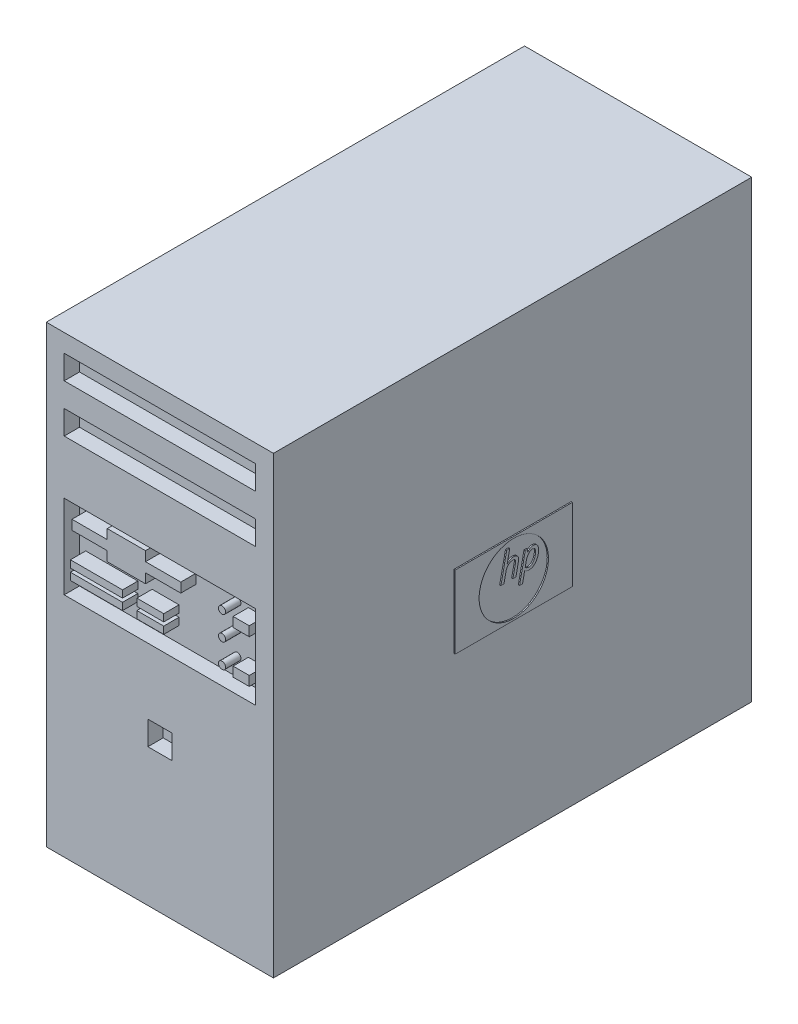
from build123d import *

# Parameters (mm, degrees)
CROQUIS1_W              = 400
CROQUIS1_H              = 380
SALIENTE_EXTRUIR1_DEPTH = 95
CROQUIS2_W              = 30.4
CROQUIS2_H              = 21.7
CROQUIS2_W_2            = 1
CROQUIS2_H_2            = 5
CORTAR_EXTRUIR1_DEPTH   = 14
CROQUIS3_W              = 45
CROQUIS3_H              = 150
CROQUIS3_W_2            = 100
CROQUIS3_H_2            = 15
SALIENTE_EXTRUIR2_DEPTH = 3
CROQUIS4_R              = 6.15
CROQUIS4_R_2            = 4
CROQUIS4_W              = 5
CROQUIS4_H              = 13
CROQUIS4_W_2            = 12
SALIENTE_EXTRUIR3_DEPTH = 5
CROQUIS5_R              = 4.1
CROQUIS5_R_2            = 5.55
SALIENTE_EXTRUIR4_DEPTH = 5
CROQUIS6_W              = 160
CROQUIS6_H              = 70
CROQUIS6_W_2            = 43.6
CROQUIS6_H_2            = 6
CROQUIS6_W_3            = 22.5
CROQUIS6_R              = 3
CROQUIS6_W_4            = 13.5
CROQUIS6_H_3            = 8
CROQUIS6_H_4            = 20
CROQUIS6_W_5            = 20
CORTAR_EXTRUIR2_DEPTH   = 12.8
ENVOLVER1_DEPTH         = 1
CROQUIS11_W             = 98
CROQUIS11_H             = 61
CROQUIS11_R             = 29
SALIENTE_EXTRUIR5_DEPTH = 1
ENVOLVER2_DEPTH         = 1
SALIENTE_EXTRUIR6_START = 1
CROQUIS13_W             = 98
CROQUIS13_H             = 61
CROQUIS13_R             = 29
SALIENTE_EXTRUIR6_DEPTH = 1
CROQUIS14_W             = 360
CROQUIS14_H             = 378
CORTAR_EXTRUIR3_DEPTH   = 94


# Read off the part's stored shape, not the designer's step: Envolver1, Envolver2
with BuildPart() as part:
    # Croquis1 → Saliente-Extruir1 (new, symmetric)
    with BuildSketch(Plane(origin=(0, 0, 0), x_dir=(0, 0, -1), z_dir=(1, 0, 0))):
        Rectangle(CROQUIS1_W, CROQUIS1_H)
    extrude(amount=SALIENTE_EXTRUIR1_DEPTH, both=True)

    # Croquis2 → Cortar-Extruir1 (cut)
    # profile 1 of 5: a face of its own
    with BuildSketch(Plane(origin=(0, 0, -200), x_dir=(-1, 0, 0), z_dir=(0, 0, -1))):
        with Locations((-55, 160)):
            Rectangle(CROQUIS2_W, CROQUIS2_H)
        Polygon((-42, 151), (-68, 151), (-68, 160), (-68, 164.669872981), (-62.5, 169), (-47.5, 169), (-42, 164.669872981), (-42, 160), align=None, mode=Mode.SUBTRACT)
    # profile 2 of 5: a face of its own
    with BuildSketch(Plane(origin=(0, 0, -200), x_dir=(-1, 0, 0), z_dir=(0, 0, -1))):
        with Locations((-55, 162.856907895)):
            Rectangle(CROQUIS2_W_2, CROQUIS2_H_2)
    # profile 3 of 5: a face of its own
    with BuildSketch(Plane(origin=(0, 0, -200), x_dir=(-1, 0, 0), z_dir=(0, 0, -1))):
        with Locations((-48.5, 155)):
            Rectangle(CROQUIS2_W_2, CROQUIS2_H_2)
    # profile 4 of 5: a face of its own
    with BuildSketch(Plane(origin=(0, 0, -200), x_dir=(-1, 0, 0), z_dir=(0, 0, -1))):
        with Locations((-61.5, 155)):
            Rectangle(CROQUIS2_W_2, CROQUIS2_H_2)
    # profile 5 of 5: a face of its own
    with BuildSketch(Plane(origin=(0, 0, -200), x_dir=(-1, 0, 0), z_dir=(0, 0, -1))):
        Polygon((-85, 90), (-25, 90), (-25, -70), (30, -70), (30, -165), (-85, -165), align=None)
    extrude(amount=-CORTAR_EXTRUIR1_DEPTH, mode=Mode.SUBTRACT)

    # Croquis3 → Saliente-Extruir2 (add)
    with BuildSketch(Plane(origin=(0, 0, -186), x_dir=(-1, 0, 0), z_dir=(0, 0, -1))):
        with Locations((-58, 12.5)):
            Rectangle(CROQUIS3_W, CROQUIS3_H)
        with Locations((-22.5, -85)):
            Rectangle(CROQUIS3_W_2, CROQUIS3_H_2)
    extrude(amount=SALIENTE_EXTRUIR2_DEPTH)

    # Croquis4 → Saliente-Extruir3 (add)
    with BuildSketch(Plane(origin=(0, 0, -189), x_dir=(-1, 0, 0), z_dir=(0, 0, -1))):
        with Locations(Location((-69, 76, 0), (0, 0, 180))):
            Circle(CROQUIS4_R)
        with Locations(Location((-50, 76, 0), (0, 0, 180))):
            Circle(CROQUIS4_R)
        with Locations(Location((-68, -57.5, 0), (0, 0, 180))):
            Circle(CROQUIS4_R_2)
        with Locations(Location((-56, -57.5, 0), (0, 0, 180))):
            Circle(CROQUIS4_R_2)
        with Locations(Location((-43, -57.5, 0), (0, 0, 180))):
            Circle(CROQUIS4_R_2)
        with BuildLine():
            Line((-65.269265107, 53.441675937), (-70.469265107, 52.735154197))
            ThreePointArc((-70.469265107, 52.735154197), (-71.706408015, 52.068936991), (-72.2, 50.753363012))
            Line((-72.2, 50.753363012), (-72.2, 41.246636988))
            ThreePointArc((-72.2, 41.246636988), (-71.706408015, 39.931063009), (-70.469265107, 39.264845803))
            Line((-70.469265107, 39.264845803), (-65.269265107, 38.558324063))
            ThreePointArc((-65.269265107, 38.558324063), (-63.684426021, 39.033707234), (-63, 40.540115249))
            Line((-63, 40.540115249), (-63, 51.459884751))
            ThreePointArc((-63, 51.459884751), (-63.684426021, 52.966292766), (-65.269265107, 53.441675937))
        make_face()
        with BuildLine():
            Line((-52.36857707, 53.105891799), (-48.36857707, 53.855891799))
            ThreePointArc((-48.36857707, 53.855891799), (-46.722728326, 53.429165642), (-46, 51.890147425))
            Line((-46, 51.890147425), (-46, 16.709852575))
            ThreePointArc((-46, 16.709852575), (-46.722728326, 15.170834358), (-48.36857707, 14.744108201))
            Line((-48.36857707, 14.744108201), (-52.36857707, 15.494108201))
            ThreePointArc((-52.36857707, 15.494108201), (-53.539018216, 16.1825809), (-54, 17.459852575))
            Line((-54, 17.459852575), (-54, 51.140147425))
            ThreePointArc((-54, 51.140147425), (-53.539018216, 52.4174191), (-52.36857707, 53.105891799))
        make_face()
        with BuildLine():
            Line((-68.25, 23), (-70, 23))
            Line((-70, 23), (-70, 4))
            Line((-70, 4), (-68.25, 4))
            ThreePointArc((-68.25, 4), (-65, 0.75), (-61.75, 4))
            Line((-61.75, 4), (-60, 4))
            Line((-60, 4), (-60, 23))
            Line((-60, 23), (-61.75, 23))
            ThreePointArc((-61.75, 23), (-65, 26.25), (-68.25, 23))
        make_face()
        with Locations((-63, -13.5)):
            Rectangle(CROQUIS4_W, CROQUIS4_H)
        with Locations((-71, -13.5)):
            Rectangle(CROQUIS4_W, CROQUIS4_H)
        with Locations((-63, -40.5)):
            Rectangle(CROQUIS4_W, CROQUIS4_H)
        with Locations((-71, -40.5)):
            Rectangle(CROQUIS4_W, CROQUIS4_H)
        with BuildLine():
            Line((-46, -20.5), (-46, -6.5))
            Line((-46, -6.5), (-56, -6.5))
            Line((-56, -6.5), (-56, -20.5))
            ThreePointArc((-56, -20.5), (-51, -25.5), (-46, -20.5))
        make_face()
        with Locations((-50, -40.5)):
            Rectangle(CROQUIS4_W_2, CROQUIS4_H)
    extrude(amount=SALIENTE_EXTRUIR3_DEPTH)

    # Croquis5 → Saliente-Extruir4 (add)
    with BuildSketch(Plane(origin=(0, 0, -189), x_dir=(-1, 0, 0), z_dir=(0, 0, -1))):
        with Locations(Location((-13, -85, 0), (0, 0, 180))):
            Circle(CROQUIS5_R)
        with Locations(Location((-28, -85, 0), (0, 0, 180))):
            Circle(CROQUIS5_R_2)
        with BuildLine():
            Line((-54.378732187, -82.51492875), (-55.378732187, -86.51492875))
            ThreePointArc((-55.378732187, -86.51492875), (-55.014858063, -88.230824419), (-53.438447187, -89))
            Line((-53.438447187, -89), (-42.561552813, -89))
            ThreePointArc((-42.561552813, -89), (-40.985141937, -88.230824419), (-40.621267813, -86.51492875))
            Line((-40.621267813, -86.51492875), (-41.621267813, -82.51492875))
            ThreePointArc((-41.621267813, -82.51492875), (-42.330728394, -81.423589124), (-43.561552813, -81))
            Line((-43.561552813, -81), (-52.438447187, -81))
            ThreePointArc((-52.438447187, -81), (-53.669271606, -81.423589124), (-54.378732187, -82.51492875))
        make_face()
    extrude(amount=SALIENTE_EXTRUIR4_DEPTH)

    # Croquis6 → Cortar-Extruir2 (cut)
    # profile 1 of 4: a face of its own
    with BuildSketch(Plane.XY.offset(200)):
        with Locations((0, 35)):
            Rectangle(CROQUIS6_W, CROQUIS6_H)
        with Locations((-53, 16)):
            Rectangle(CROQUIS6_W_2, CROQUIS6_H_2, mode=Mode.SUBTRACT)
        with Locations((-53, 25)):
            Rectangle(CROQUIS6_W_2, CROQUIS6_H_2, mode=Mode.SUBTRACT)
        with Locations((-8, 16)):
            Rectangle(CROQUIS6_W_3, CROQUIS6_H_2, mode=Mode.SUBTRACT)
        with Locations((-8, 25)):
            Rectangle(CROQUIS6_W_3, CROQUIS6_H_2, mode=Mode.SUBTRACT)
        with Locations((52, 15)):
            Circle(CROQUIS6_R, mode=Mode.SUBTRACT)
        with Locations((68, 15)):
            Rectangle(CROQUIS6_W_4, CROQUIS6_H_3, mode=Mode.SUBTRACT)
        with Locations((52, 35)):
            Circle(CROQUIS6_R, mode=Mode.SUBTRACT)
        Polygon((17.5, 58), (17.5, 50), (-12, 50), (-12, 42), (-44, 42), (-44, 50), (-73.5, 50), (-73.5, 58), (-44, 58), (-44, 66), (-12, 66), (-12, 58), align=None, mode=Mode.SUBTRACT)
        with Locations((52, 55)):
            Circle(CROQUIS6_R, mode=Mode.SUBTRACT)
        with Locations((68, 51)):
            Rectangle(CROQUIS6_W_4, CROQUIS6_H_3, mode=Mode.SUBTRACT)
    # profile 2 of 4: a face of its own
    with BuildSketch(Plane.XY.offset(200)):
        with Locations((0, 165)):
            Rectangle(CROQUIS6_W, CROQUIS6_H_4)
    # profile 3 of 4: a face of its own
    with BuildSketch(Plane.XY.offset(200)):
        with Locations((0, 125)):
            Rectangle(CROQUIS6_W, CROQUIS6_H_4)
    # profile 4 of 4: a face of its own
    with BuildSketch(Plane.XY.offset(200)):
        with Locations((0, -65)):
            Rectangle(CROQUIS6_W_5, CROQUIS6_H_4)
    extrude(amount=-CORTAR_EXTRUIR2_DEPTH, mode=Mode.SUBTRACT)

    # Envolver1 outline → Envolver1 (add)
    # profile 1 of 2: a face of its own
    with BuildSketch(Plane.ZY.offset(95)):
        with BuildLine():
            add(Edge.make_bspline(
                [(7.181198595, 11.423049884), (7.337619147, 11.610028115), (7.6376853, 11.968713966), (8.140874147, 12.42272072), (8.641987971, 12.802255602), (9.155396307, 13.094519079), (9.667215756, 13.319715287), (10.181723883, 13.462802192), (10.685270473, 13.548973438), (11.017664645, 13.561747174), (11.180097426, 13.567989382)],
                knots=[0, 0, 0, 0, 0.155479612, 0.298261122, 0.43168685, 0.556135977, 0.674636922, 0.787784901, 0.896295749, 1, 1, 1, 1], degree=3))
            Line((7.181198595, 11.423049884), (7.127159422, 11.423049884))
            Line((7.127159422, 11.423049884), (7.127159422, 13.301950374))
            Line((7.127159422, 13.301950374), (5.3438667, 13.301950374))
            Line((5.3438667, 13.301950374), (1.220262084, -6.650975187))
            Line((1.220262084, -6.650975187), (3.394299598, -6.650975187))
            Line((3.394299598, -6.650975187), (4.936494469, 0.910352229))
            Line((4.936494469, 0.910352229), (4.994690502, 0.910352229))
            add(Edge.make_bspline(
                [(8.20794289, -0.266039007), (8.037368303, -0.261813107), (7.704892979, -0.253576197), (7.221505063, -0.196542189), (6.7684401, -0.094839664), (6.343961468, 0.03977446), (5.95457134, 0.215778471), (5.597588372, 0.416083364), (5.273692918, 0.642728496), (5.086822322, 0.821977863), (4.994690502, 0.910352229)],
                knots=[0, 0, 0, 0, 0.145681742, 0.283955455, 0.414883353, 0.541753133, 0.663594403, 0.779116523, 0.891098989, 1, 1, 1, 1], degree=3))
            add(Edge.make_bspline(
                [(15.012721878, 8.83748328), (15.004250511, 8.48643384), (14.987069457, 7.774459139), (14.834861884, 6.707706081), (14.59790044, 5.646762082), (14.260908987, 4.616803133), (13.834285556, 3.631406182), (13.395613861, 2.860838754), (13.005035994, 2.280892406), (12.681328192, 1.880036421), (12.336947648, 1.506549793), (11.971437125, 1.158845058), (11.579234251, 0.848141836), (11.167492604, 0.565921904), (10.727432787, 0.327664624), (10.270835212, 0.111705745), (9.788244842, -0.059209456), (9.28116875, -0.180014267), (8.751744051, -0.251088704), (8.391059336, -0.261004729), (8.20794289, -0.266039007)],
                knots=[0, 0, 0, 0, 0.083553628, 0.16945781, 0.256063076, 0.342141958, 0.427100653, 0.511322591, 0.55287012, 0.593474168, 0.633868555, 0.673780361, 0.713456906, 0.752898169, 0.792475818, 0.832480252, 0.873073575, 0.914126889, 0.956402979, 1, 1, 1, 1], degree=3))
            add(Edge.make_bspline(
                [(11.180097426, 13.567989382), (11.328512861, 13.563695426), (11.618206663, 13.555314004), (12.041419882, 13.498740974), (12.437888082, 13.392886329), (12.810101717, 13.251297268), (13.158432683, 13.073507285), (13.474120999, 12.850436773), (13.76453574, 12.595638499), (14.022727761, 12.302596699), (14.249985661, 11.975595183), (14.458177271, 11.621142722), (14.625092925, 11.228527296), (14.766751146, 10.807393506), (14.87933591, 10.357260893), (14.957655352, 9.876238233), (15.002485001, 9.36626307), (15.00925977, 9.016316389), (15.012721878, 8.83748328)],
                knots=[0, 0, 0, 0, 0.064627816, 0.126147782, 0.185416525, 0.242898704, 0.299297273, 0.355199899, 0.410766162, 0.46718409, 0.524767504, 0.583962499, 0.645836471, 0.71013394, 0.777300063, 0.84762476, 0.922131743, 1, 1, 1, 1], degree=3))
        make_face()
        with BuildLine():
            add(Edge.make_bspline(
                [(8.008413634, 1.596234045), (8.145904154, 1.599629808), (8.415650279, 1.606292041), (8.808644132, 1.676366986), (9.182576297, 1.782389573), (9.533552722, 1.939903463), (9.86569487, 2.132374959), (10.181164713, 2.352369289), (10.479057895, 2.599613416), (10.851715371, 2.968893428), (11.276868937, 3.492443722), (11.696816352, 4.201518363), (12.054807398, 4.954069366), (12.341196395, 5.734533677), (12.560295662, 6.522133876), (12.715179698, 7.300488518), (12.816713196, 8.042243173), (12.828802231, 8.522665141), (12.834527504, 8.75018923)],
                knots=[0, 0, 0, 0, 0.043484222, 0.085312793, 0.125986784, 0.166251837, 0.206733761, 0.247379355, 0.287875537, 0.329132024, 0.413332572, 0.500527523, 0.589415335, 0.676853816, 0.763384145, 0.847952988, 0.927991724, 1, 1, 1, 1], degree=3))
            add(Edge.make_bspline(
                [(5.289827526, 2.668703794), (5.455146508, 2.52803495), (5.796584391, 2.237507683), (6.293251646, 1.946364594), (6.745494846, 1.764579503), (7.132191295, 1.665068532), (7.557776914, 1.608247411), (7.854433746, 1.600338941), (8.008413634, 1.596234045)],
                knots=[0, 0, 0, 0, 0.216841357, 0.447848473, 0.571617641, 0.703367353, 0.846032665, 1, 1, 1, 1], degree=3))
            Line((5.289827526, 2.668703794), (6.087944549, 6.447289072))
            add(Edge.make_bspline(
                [(10.677117428, 11.705716329), (10.565851818, 11.702346667), (10.339699532, 11.69549768), (10.000309573, 11.617250487), (9.653879032, 11.506610607), (9.306163775, 11.347272681), (8.961703811, 11.147232042), (8.624227167, 10.908775097), (8.293885961, 10.633034006), (7.975299331, 10.316426956), (7.665794052, 9.962644536), (7.37619129, 9.566279644), (7.101936957, 9.132675475), (6.844231251, 8.664488555), (6.611288845, 8.15880278), (6.403664838, 7.620761642), (6.228607006, 7.046369076), (6.135579577, 6.650166184), (6.087944549, 6.447289072)],
                knots=[0, 0, 0, 0, 0.044593001, 0.090637253, 0.139194115, 0.19048493, 0.243825636, 0.29892729, 0.356196554, 0.416385376, 0.479082712, 0.544731655, 0.61325705, 0.68496283, 0.75913814, 0.836625524, 0.916343513, 1, 1, 1, 1], degree=3))
            add(Edge.make_bspline(
                [(12.834527504, 8.75018923), (12.831390628, 8.888755826), (12.82542331, 9.152352746), (12.800934293, 9.531094627), (12.739818088, 9.870577356), (12.667873206, 10.177591332), (12.569958338, 10.450777564), (12.45932043, 10.694398638), (12.335006997, 10.912093643), (12.143216521, 11.149004392), (11.874063349, 11.394898466), (11.493009614, 11.581232651), (11.090326605, 11.686952329), (10.814909725, 11.699459124), (10.677117428, 11.705716329)],
                knots=[0, 0, 0, 0, 0.100014081, 0.190258003, 0.273418839, 0.348582045, 0.41751, 0.482374466, 0.541525435, 0.597730836, 0.701837991, 0.801536814, 0.90070798, 1, 1, 1, 1], degree=3))
        make_face(mode=Mode.SUBTRACT)
    # profile 2 of 2: a face of its own
    with BuildSketch(Plane.ZY.offset(95)):
        with BuildLine():
            add(Edge.make_bspline(
                [(-3.140283523, 13.567989382), (-3.005761767, 13.566005865), (-2.74020578, 13.562090256), (-2.352668071, 13.519075608), (-1.981287783, 13.453093518), (-1.630598179, 13.358761202), (-1.30088264, 13.236209372), (-0.992427357, 13.097922054), (-0.711207294, 12.929787267), (-0.457531153, 12.737443588), (-0.22457297, 12.52436943), (-0.022506692, 12.282920715), (0.154695078, 12.0188772), (0.299495714, 11.730679552), (0.416631645, 11.420074631), (0.504277178, 11.088996158), (0.554499532, 10.734547341), (0.560426238, 10.492073258), (0.563478284, 10.367207573)],
                knots=[0, 0, 0, 0, 0.072973097, 0.144054341, 0.211309938, 0.277523406, 0.340802667, 0.402038509, 0.460713958, 0.518162404, 0.574562949, 0.631655979, 0.688590335, 0.746767398, 0.806261046, 0.868454294, 0.932258555, 1, 1, 1, 1], degree=3))
            add(Edge.make_bspline(
                [(-7.658789791, 11.423049884), (-7.513793623, 11.58424481), (-7.226157451, 11.904015271), (-6.739205185, 12.324390444), (-6.217945464, 12.691013876), (-5.664111131, 13.005713934), (-5.075628902, 13.255041205), (-4.457905308, 13.441843912), (-3.807436944, 13.544773894), (-3.365091176, 13.560166565), (-3.140283523, 13.567989382)],
                knots=[0, 0, 0, 0, 0.125823454, 0.249602296, 0.37262539, 0.495503629, 0.618821175, 0.743077844, 0.869427785, 1, 1, 1, 1], degree=3))
            Line((-7.658789791, 11.423049884), (-7.716985824, 11.423049884))
            Line((-7.716985824, 11.423049884), (-5.879653929, 20.218964569))
            Line((-5.879653929, 20.218964569), (-8.053691443, 20.218964569))
            Line((-8.053691443, 20.218964569), (-12.277060687, 0))
            Line((-12.277060687, 0), (-10.098866313, 0))
            Line((-10.098866313, 0), (-8.573298879, 7.291131549))
            add(Edge.make_bspline(
                [(-3.676518398, 11.705716329), (-3.830526413, 11.701783618), (-4.134292427, 11.694026721), (-4.58309524, 11.630415664), (-5.016101153, 11.522264876), (-5.430937424, 11.371175564), (-5.826939083, 11.189385814), (-6.199260733, 10.971059061), (-6.549894386, 10.720679786), (-6.8779758, 10.437981763), (-7.181573049, 10.125494912), (-7.460173552, 9.786186099), (-7.720583931, 9.425251848), (-7.947598233, 9.034247904), (-8.144429803, 8.622480418), (-8.323455572, 8.197355838), (-8.462797712, 7.750887184), (-8.536227129, 7.445373776), (-8.573298879, 7.291131549)],
                knots=[0, 0, 0, 0, 0.064582355, 0.127382492, 0.189691172, 0.251466219, 0.312318356, 0.372230549, 0.432230079, 0.492815148, 0.553647851, 0.614746539, 0.676840684, 0.740141804, 0.804090713, 0.868205816, 0.933462075, 1, 1, 1, 1], degree=3))
            add(Edge.make_bspline(
                [(-1.668755263, 9.860070715), (-1.674166758, 10.014881615), (-1.684344305, 10.306038769), (-1.805255824, 10.704609), (-1.983758967, 11.035575747), (-2.229455275, 11.291789226), (-2.527473092, 11.484701326), (-2.875453214, 11.613359409), (-3.264112316, 11.693595956), (-3.536156285, 11.701591169), (-3.676518398, 11.705716329)],
                knots=[0, 0, 0, 0, 0.148916788, 0.280071933, 0.398003961, 0.50866924, 0.618824369, 0.737775446, 0.864704252, 1, 1, 1, 1], degree=3))
            add(Edge.make_bspline(
                [(-1.905696254, 8.122503447), (-1.881339111, 8.234581577), (-1.835450199, 8.445737018), (-1.783052934, 8.744282795), (-1.739469423, 9.004550546), (-1.703971312, 9.285845719), (-1.674869429, 9.567079416), (-1.670549109, 9.774109513), (-1.668755263, 9.860070715)],
                knots=[0, 0, 0, 0, 0.195855155, 0.368991538, 0.517605008, 0.646460244, 0.853206356, 1, 1, 1, 1], degree=3))
            Line((-1.905696254, 8.122503447), (-3.605851787, 0))
            Line((-3.605851787, 0), (-1.431814272, 0))
            Line((-1.431814272, 0), (0.239243244, 7.960385927))
            add(Edge.make_bspline(
                [(0.563478284, 10.367207573), (0.559993208, 10.179908591), (0.552793085, 9.792951286), (0.47374218, 9.201268178), (0.37169378, 8.585871648), (0.283780644, 8.170709789), (0.239243244, 7.960385927)],
                knots=[0, 0, 0, 0, 0.230804658, 0.476839474, 0.734963269, 1, 1, 1, 1], degree=3))
        make_face()
    extrude(amount=ENVOLVER1_DEPTH)

    # Croquis11 → Saliente-Extruir5 (add)
    with BuildSketch(Plane.ZY.offset(95)):
        Rectangle(CROQUIS11_W, CROQUIS11_H)
        Circle(CROQUIS11_R, mode=Mode.SUBTRACT)
    extrude(amount=SALIENTE_EXTRUIR5_DEPTH)

    # Envolver2 outline → Envolver2 (add)
    # profile 1 of 2: a face of its own
    with BuildSketch(Plane(origin=(95, 0, 0), x_dir=(0, 0, -1), z_dir=(1, 0, 0))):
        with BuildLine():
            add(Edge.make_bspline(
                [(11.702671829, 13.200635453), (11.883433595, 13.4167101), (12.23019422, 13.831212463), (12.811686255, 14.355868987), (13.390780365, 14.79446478), (13.984082185, 15.132208522), (14.575547865, 15.392448395), (15.170120619, 15.557801614), (15.752026067, 15.657382305), (16.1361454, 15.672143812), (16.323854982, 15.679357394)],
                knots=[0, 0, 0, 0, 0.155479612, 0.298261122, 0.43168685, 0.556135977, 0.674636922, 0.787784901, 0.896295749, 1, 1, 1, 1], degree=3))
            Line((11.702671829, 13.200635453), (11.640223408, 13.200635453))
            Line((11.640223408, 13.200635453), (11.640223408, 15.371919014))
            Line((11.640223408, 15.371919014), (9.579425515, 15.371919014))
            Line((9.579425515, 15.371919014), (4.814130621, -7.685959507))
            Line((4.814130621, -7.685959507), (7.326478634, -7.685959507))
            Line((7.326478634, -7.685959507), (9.108660495, 1.052015708))
            Line((9.108660495, 1.052015708), (9.175912641, 1.052015708))
            add(Edge.make_bspline(
                [(12.889191828, -0.30743838), (12.692073461, -0.302554871), (12.307860348, -0.293036183), (11.749250544, -0.227126889), (11.225682367, -0.109598035), (10.73514895, 0.04596392), (10.285164298, 0.249356605), (9.872629811, 0.480831728), (9.498331716, 0.742745997), (9.282381454, 0.94988906), (9.175912641, 1.052015708)],
                knots=[0, 0, 0, 0, 0.145681742, 0.283955455, 0.414883353, 0.541753133, 0.663594403, 0.779116523, 0.891098989, 1, 1, 1, 1], degree=3))
            add(Edge.make_bspline(
                [(20.752889148, 10.212718695), (20.743099518, 9.807041075), (20.723244854, 8.984273201), (20.547351664, 7.751518518), (20.273515721, 6.525476865), (19.884083707, 5.335241965), (19.391071731, 4.196503533), (18.884136614, 3.306025087), (18.432779394, 2.635831014), (18.058698153, 2.172596258), (17.660727202, 1.740989912), (17.238338153, 1.339177481), (16.785103053, 0.980124512), (16.309288674, 0.65398723), (15.800749425, 0.378653801), (15.273098911, 0.129088714), (14.715410762, -0.068423272), (14.129426571, -0.208026993), (13.51761602, -0.290161601), (13.100803742, -0.301620698), (12.889191828, -0.30743838)],
                knots=[0, 0, 0, 0, 0.083553628, 0.16945781, 0.256063076, 0.342141958, 0.427100653, 0.511322591, 0.55287012, 0.593474168, 0.633868555, 0.673780361, 0.713456906, 0.752898169, 0.792475818, 0.832480252, 0.873073575, 0.914126889, 0.956402979, 1, 1, 1, 1], degree=3))
            add(Edge.make_bspline(
                [(16.323854982, 15.679357394), (16.495365924, 15.674395239), (16.830140114, 15.664709551), (17.319211202, 15.599332971), (17.777375372, 15.477005869), (18.207510631, 15.313383579), (18.610046743, 15.107927), (18.974860556, 14.850143612), (19.310467873, 14.555695179), (19.608838166, 14.217051997), (19.871460559, 13.839164493), (20.112049682, 13.429554295), (20.304939735, 12.975842444), (20.468641946, 12.489174373), (20.598746467, 11.96899486), (20.689253505, 11.413118378), (20.741059271, 10.823783981), (20.748888288, 10.419380725), (20.752889148, 10.212718695)],
                knots=[0, 0, 0, 0, 0.064627816, 0.126147782, 0.185416525, 0.242898704, 0.299297273, 0.355199899, 0.410766162, 0.46718409, 0.524767504, 0.583962499, 0.645836471, 0.71013394, 0.777300063, 0.84762476, 0.922131743, 1, 1, 1, 1], degree=3))
        make_face()
        with BuildLine():
            add(Edge.make_bspline(
                [(12.658613042, 1.844630282), (12.817499001, 1.848554473), (13.129221379, 1.856253442), (13.583370545, 1.937233024), (14.01549176, 2.059754202), (14.421085002, 2.241779445), (14.804913092, 2.464202185), (15.169474434, 2.718430695), (15.513723942, 3.00414945), (15.944372108, 3.430894572), (16.435685487, 4.035916579), (16.920982565, 4.855333105), (17.334682002, 5.72499152), (17.665637114, 6.626906941), (17.918831276, 7.537068694), (18.097817423, 8.436546154), (18.215150947, 9.293728158), (18.229121205, 9.848910472), (18.23573741, 10.111840476)],
                knots=[0, 0, 0, 0, 0.043484222, 0.085312793, 0.125986784, 0.166251837, 0.206733761, 0.247379355, 0.287875537, 0.329132024, 0.413332572, 0.500527523, 0.589415335, 0.676853816, 0.763384145, 0.847952988, 0.927991724, 1, 1, 1, 1], degree=3))
            add(Edge.make_bspline(
                [(9.516977094, 3.083991252), (9.708022011, 2.921432378), (10.102592381, 2.585695025), (10.676547974, 2.249246018), (11.199166511, 2.039172637), (11.64603831, 1.924176373), (12.137850976, 1.858513095), (12.48067174, 1.849373956), (12.658613042, 1.844630282)],
                knots=[0, 0, 0, 0, 0.216841357, 0.447848473, 0.571617641, 0.703367353, 0.846032665, 1, 1, 1, 1], degree=3))
            Line((9.516977094, 3.083991252), (10.439292235, 7.450576997))
            add(Edge.make_bspline(
                [(15.742604295, 13.527288732), (15.614024208, 13.523394704), (15.352679477, 13.515479919), (14.960475717, 13.425056374), (14.560135762, 13.297199388), (14.15831117, 13.113066262), (13.760248441, 12.881896515), (13.370255733, 12.606332351), (12.988508837, 12.287682108), (12.620345693, 11.921806594), (12.262677084, 11.512970705), (11.928008101, 11.054925918), (11.611075977, 10.553846905), (11.313267675, 10.012803583), (11.044076189, 9.428426062), (10.804142996, 8.806658233), (10.601843729, 8.142882189), (10.494339937, 7.685024612), (10.439292235, 7.450576997)],
                knots=[0, 0, 0, 0, 0.044593001, 0.090637253, 0.139194115, 0.19048493, 0.243825636, 0.29892729, 0.356196554, 0.416385376, 0.479082712, 0.544731655, 0.61325705, 0.68496283, 0.75913814, 0.836625524, 0.916343513, 1, 1, 1, 1], degree=3))
            add(Edge.make_bspline(
                [(18.23573741, 10.111840476), (18.232112392, 10.271969963), (18.225216476, 10.576586233), (18.196916628, 11.014265622), (18.12628989, 11.40657659), (18.043149383, 11.761366214), (17.929997599, 12.077064027), (17.802142892, 12.358595931), (17.658484558, 12.610167309), (17.436848814, 12.883944669), (17.125811663, 13.168103283), (16.685460662, 13.383433661), (16.220114571, 13.505604793), (15.901838992, 13.520057819), (15.742604295, 13.527288732)],
                knots=[0, 0, 0, 0, 0.100014081, 0.190258003, 0.273418839, 0.348582045, 0.41751, 0.482374466, 0.541525435, 0.597730836, 0.701837991, 0.801536814, 0.90070798, 1, 1, 1, 1], degree=3))
        make_face(mode=Mode.SUBTRACT)
    # profile 2 of 2: a face of its own
    with BuildSketch(Plane(origin=(95, 0, 0), x_dir=(0, 0, -1), z_dir=(1, 0, 0))):
        with BuildLine():
            add(Edge.make_bspline(
                [(-0.224976581, 15.679357394), (-0.069521367, 15.677065215), (0.237358828, 15.672540282), (0.685202799, 15.622831957), (1.114375029, 15.546582135), (1.519636817, 15.437570397), (1.900660684, 15.295947797), (2.257115902, 15.136141047), (2.582097722, 14.941842147), (2.875249402, 14.719567114), (3.14445912, 14.473335651), (3.377969724, 14.194314155), (3.582746556, 13.889181793), (3.750080186, 13.55613658), (3.885444099, 13.19719721), (3.986728497, 12.814598318), (4.044766149, 12.404992331), (4.051615132, 12.124785906), (4.055142119, 11.980489382)],
                knots=[0, 0, 0, 0, 0.072973097, 0.144054341, 0.211309938, 0.277523406, 0.340802667, 0.402038509, 0.460713958, 0.518162404, 0.574562949, 0.631655979, 0.688590335, 0.746767398, 0.806261046, 0.868454294, 0.932258555, 1, 1, 1, 1], degree=3))
            add(Edge.make_bspline(
                [(-5.446625321, 13.200635453), (-5.279065731, 13.386914554), (-4.946669367, 13.75644575), (-4.38394055, 14.242237151), (-3.781565561, 14.665912293), (-3.141546896, 15.029584061), (-2.46148864, 15.317710125), (-1.747638656, 15.533581934), (-0.995948361, 15.652529254), (-0.484767434, 15.670317238), (-0.224976581, 15.679357394)],
                knots=[0, 0, 0, 0, 0.125823454, 0.249602296, 0.37262539, 0.495503629, 0.618821175, 0.743077844, 0.869427785, 1, 1, 1, 1], degree=3))
            Line((-5.446625321, 13.200635453), (-5.513877467, 13.200635453))
            Line((-5.513877467, 13.200635453), (-3.390631153, 23.365316901))
            Line((-3.390631153, 23.365316901), (-5.902979167, 23.365316901))
            Line((-5.902979167, 23.365316901), (-10.783563454, 0))
            Line((-10.783563454, 0), (-8.266411716, 0))
            Line((-8.266411716, 0), (-6.503444754, 8.42573311))
            add(Edge.make_bspline(
                [(-0.844657067, 13.527288732), (-1.022630872, 13.522744036), (-1.373667107, 13.513780059), (-1.892309885, 13.440270236), (-2.392697545, 13.31528968), (-2.872088115, 13.140688768), (-3.329713144, 12.930610002), (-3.759973225, 12.678308567), (-4.165170355, 12.388966791), (-4.544305805, 12.062277021), (-4.895147011, 11.701162866), (-5.217101631, 11.309052878), (-5.51803549, 10.891952234), (-5.780376377, 10.440102634), (-6.007837679, 9.964258395), (-6.21472235, 9.472978512), (-6.375748067, 8.957033122), (-6.460604123, 8.603977574), (-6.503444754, 8.42573311)],
                knots=[0, 0, 0, 0, 0.064582355, 0.127382492, 0.189691172, 0.251466219, 0.312318356, 0.372230549, 0.432230079, 0.492815148, 0.553647851, 0.614746539, 0.676840684, 0.740141804, 0.804090713, 0.868205816, 0.933462075, 1, 1, 1, 1], degree=3))
            add(Edge.make_bspline(
                [(1.47554196, 11.394434969), (1.469288361, 11.5733366), (1.457527046, 11.90980186), (1.317800012, 12.370395167), (1.111519295, 12.752864948), (0.827589222, 13.04894881), (0.483195684, 13.271880718), (0.081065011, 13.42055979), (-0.368074858, 13.51328226), (-0.682452655, 13.52252164), (-0.844657067, 13.527288732)],
                knots=[0, 0, 0, 0, 0.148916788, 0.280071933, 0.398003961, 0.50866924, 0.618824369, 0.737775446, 0.864704252, 1, 1, 1, 1], degree=3))
            add(Edge.make_bspline(
                [(1.201729652, 9.386478048), (1.229877106, 9.515997095), (1.282906971, 9.760011262), (1.34345798, 10.105014918), (1.393823692, 10.405783953), (1.434845803, 10.73085257), (1.468476344, 11.055850146), (1.473468967, 11.295097008), (1.47554196, 11.394434969)],
                knots=[0, 0, 0, 0, 0.195855155, 0.368991538, 0.517605008, 0.646460244, 0.853206356, 1, 1, 1, 1], degree=3))
            Line((1.201729652, 9.386478048), (-0.762993747, 0))
            Line((-0.762993747, 0), (1.749354267, 0))
            Line((1.749354267, 0), (3.680451593, 9.199132785))
            add(Edge.make_bspline(
                [(4.055142119, 11.980489382), (4.051114717, 11.764044071), (4.042794155, 11.316870823), (3.951441828, 10.633113587), (3.833513277, 9.921952791), (3.731919634, 9.442185968), (3.680451593, 9.199132785)],
                knots=[0, 0, 0, 0, 0.230804658, 0.476839474, 0.734963269, 1, 1, 1, 1], degree=3))
        make_face()
    extrude(amount=ENVOLVER2_DEPTH)

    # Croquis13 → Saliente-Extruir6 (add)
    with BuildSketch(Plane(origin=(95, 0, 0), x_dir=(0, 0, -1), z_dir=(1, 0, 0)).offset(SALIENTE_EXTRUIR6_START)):
        Rectangle(CROQUIS13_W, CROQUIS13_H)
        with Locations(Location((0, 0, 0), (0, 0, 180))):
            Circle(CROQUIS13_R, mode=Mode.SUBTRACT)
    extrude(amount=-SALIENTE_EXTRUIR6_DEPTH)

    # Croquis14 → Cortar-Extruir3 (cut, symmetric)
    with BuildSketch(Plane(origin=(0, 0, 0), x_dir=(0, 0, -1), z_dir=(1, 0, 0))):
        Rectangle(CROQUIS14_W, CROQUIS14_H)
    extrude(amount=CORTAR_EXTRUIR3_DEPTH, both=True, mode=Mode.SUBTRACT)


solid = part.part
